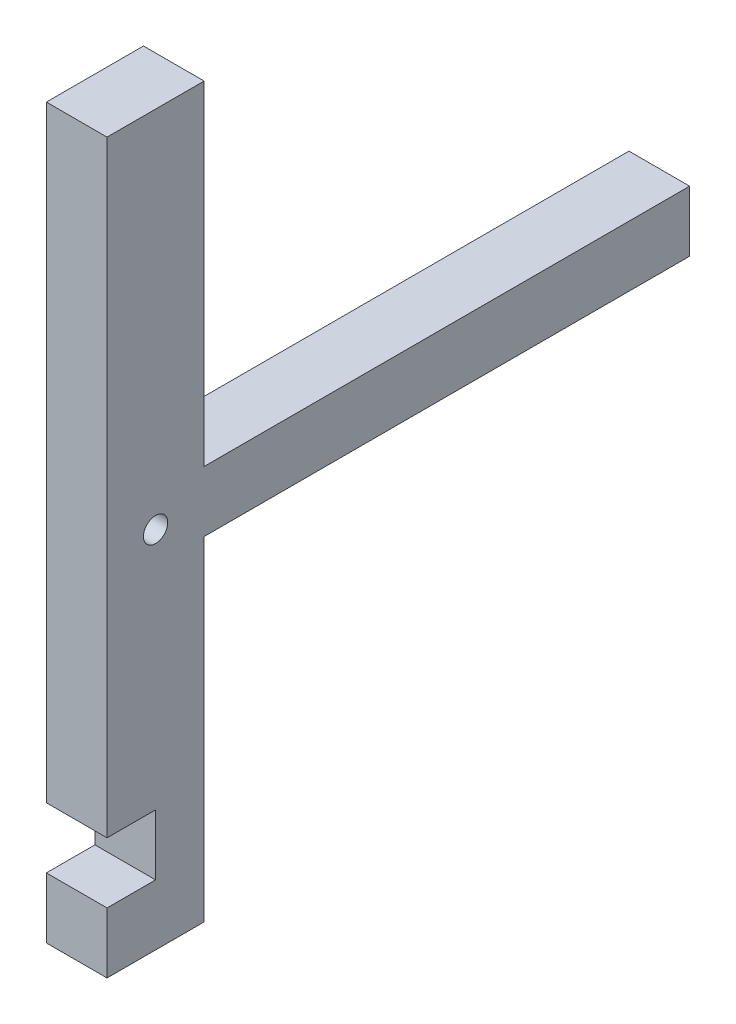
from build123d import *

# Parameters (mm, degrees)
ELEVATOR_PADDLE_R   = 1.27
BOSS_EXTRUDE1_DEPTH = 6.35


with BuildPart() as part:
    # Elevator Paddle → Boss-Extrude1 (new body)
    with BuildSketch(Plane(origin=(0, 0, 0), x_dir=(0, 0, -1), z_dir=(1, 0, 0))):
        Polygon((-5.08, -31.75), (-5.08, -38.1), (5.08, -38.1), (5.08, -3.175), (55.88, -3.175), (55.88, 3.175), (5.08, 3.175), (5.08, 38.1), (-5.08, 38.1), (-5.08, -25.4), (0, -25.4), (0, -31.75), align=None)
        Circle(ELEVATOR_PADDLE_R, mode=Mode.SUBTRACT)
    extrude(amount=BOSS_EXTRUDE1_DEPTH)


solid = part.part
